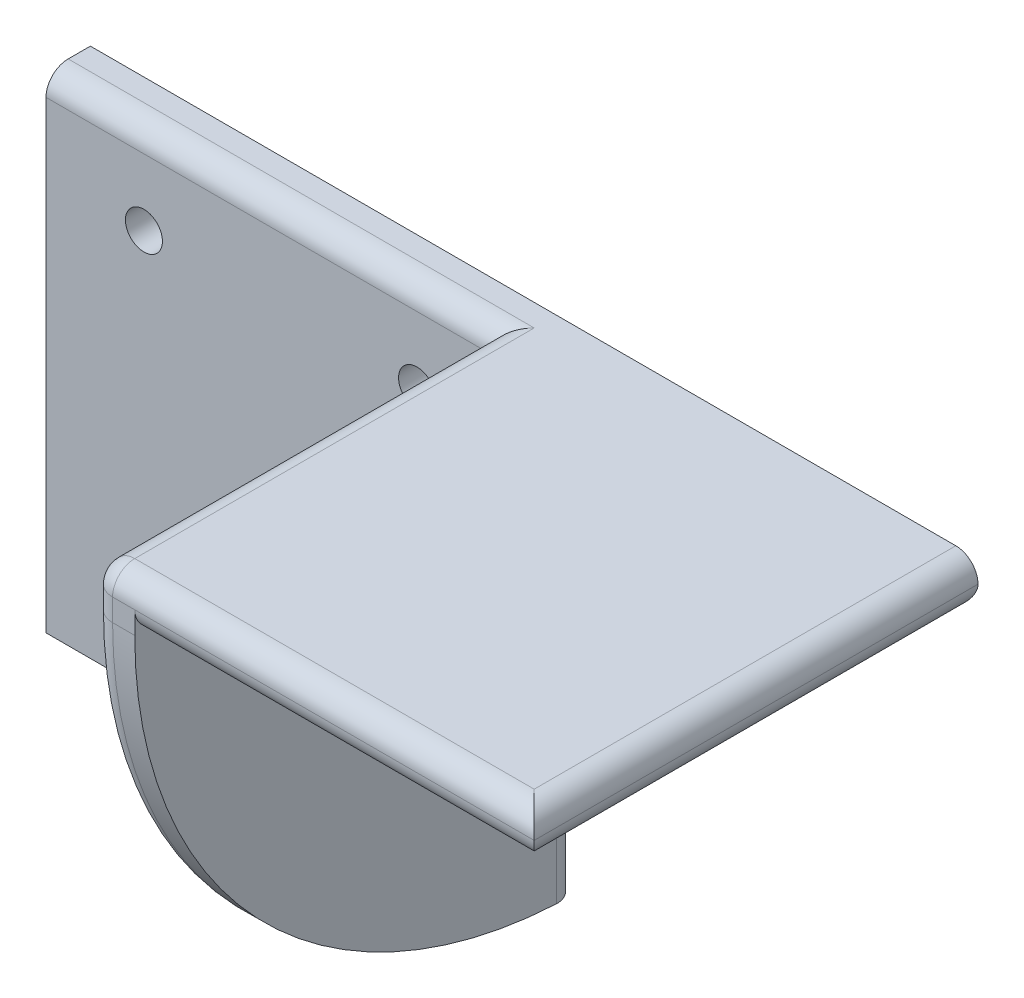
from build123d import *

# Parameters (mm, degrees)
SKETCH_1_W          = 60
SKETCH_1_H          = 60
EXTRUDE_312_DEPTH   = 6
SKETCH_2_W          = 6
SKETCH_2_H          = 60
EXTRUDE_2_DEPTH     = 60
SKETCH_3_W          = 6
SKETCH_3_H          = 66
EXTRUDE_708_DEPTH   = 60
FILLET_1_R          = 60
SKETCH_4_R          = 2.5
CUT_EXTRUDE_1_DEPTH = 6
FILLET_2_R          = 3
FILLET_3_R          = 3
FILLET_4_R          = 3
FILLET_7_R          = 3


with BuildPart() as part:
    # Эскиз1 → Extrude 312 (new body)
    with BuildSketch(Plane(origin=(0, 0, 0), x_dir=(1, 0, 0), z_dir=(0, 1, 0))):
        Rectangle(SKETCH_1_W, SKETCH_1_H)
    extrude(amount=EXTRUDE_312_DEPTH)

    # Эскиз2 → Бобышка-Вытянуть2 (add)
    with BuildSketch(Plane.XZ):
        with Locations((-27, 0)):
            Rectangle(SKETCH_2_W, SKETCH_2_H)
    extrude(amount=EXTRUDE_2_DEPTH)

    # Эскиз3 → Extrude 708 (add)
    with BuildSketch(Plane.ZY.offset(30)):
        with Locations((-27, -27)):
            Rectangle(SKETCH_3_W, SKETCH_3_H)
    extrude(amount=EXTRUDE_708_DEPTH)

    # Скругление1
    fillet_1_edges = [part.edges().sort_by_distance(p)[0] for p in [
        (-27, -60, 30),
    ]]
    fillet(fillet_1_edges, radius=FILLET_1_R - 0.0001)  # a hair under: the kernel refuses the full size

    # Эскиз4 → Вырез-Вытянуть1 (cut)
    with BuildSketch(Plane.XY.offset(-24)):
        with Locations((-76.761220605, -5.987815157)):
            Circle(SKETCH_4_R)
        with Locations((-39.838074985, -5.987815157)):
            Circle(SKETCH_4_R)
        with Locations((-76.761220605, -53.599239773)):
            Circle(SKETCH_4_R)
        with Locations((-39.838074985, -53.356324341)):
            Circle(SKETCH_4_R)
    extrude(amount=-CUT_EXTRUDE_1_DEPTH, mode=Mode.SUBTRACT)

    # Скругление2
    fillet_2_edges = [part.edges().sort_by_distance(p)[0] for p in [
        (-60, 6, -24),
    ]]
    fillet(fillet_2_edges, radius=FILLET_2_R)

    # Скругление3
    fillet_3_edges = [part.edges().sort_by_distance(p)[0] for p in [
        (3, 0, 30),
        (-24, -30, -30),
        (3, 0, -30),
        (30, 0, 0),
    ]]
    fillet(fillet_3_edges, radius=FILLET_3_R)

    # Скругление4
    fillet_4_edges = [part.edges().sort_by_distance(p)[0] for p in [
        (-30, 6, 1.5),
    ]]
    fillet(fillet_4_edges, radius=FILLET_4_R)

    # Скругление7
    fillet_7_edges = [part.edges().sort_by_distance(p)[0] for p in [
        (-30, -40.249290054, 14.497186422),
        (-30, 1.49995, 30),
        (-29.121320344, 5.121320344, 30),
        (30, 6, 0),
        (1.5, 6, 30),
    ]]
    fillet(fillet_7_edges, radius=FILLET_7_R - 0.0001)  # a hair under: the kernel refuses the full size


solid = part.part
